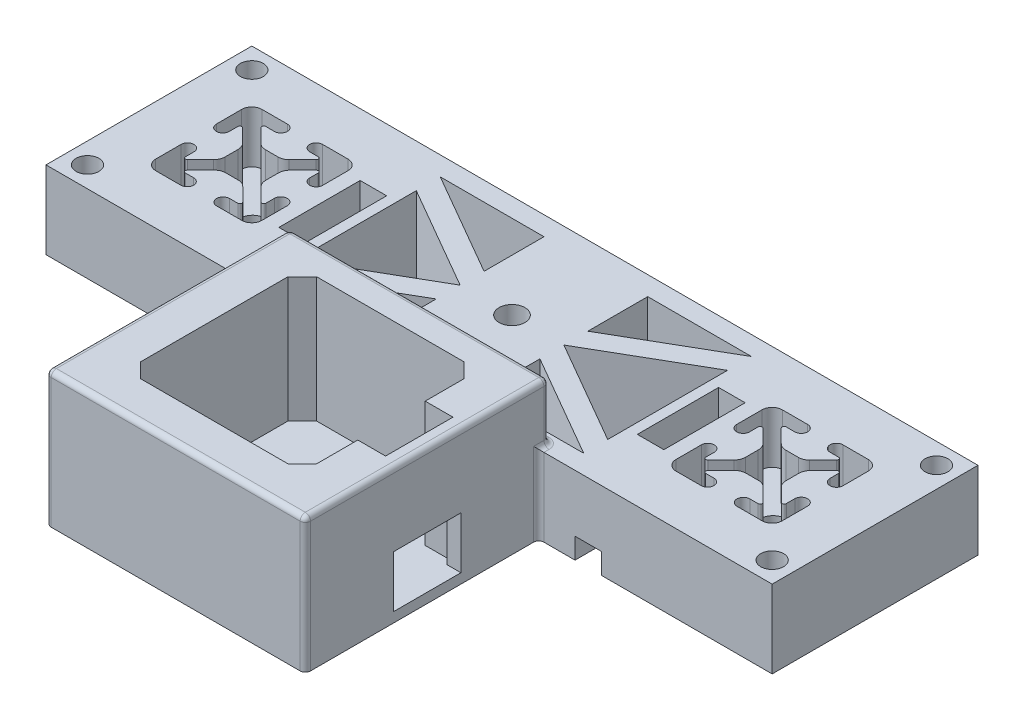
from build123d import *

# Parameters (mm, degrees)
SKETCH1_W               = 177.8
SKETCH1_H               = 50.4000008
BOSS_EXTRUDE1_DEPTH     = 6.35
SKETCH2_W               = 177.8
SKETCH2_H               = 50.4000008
BOSS_EXTRUDE2_DEPTH     = 12.7
SKETCH3_R               = 3.175
CUT_EXTRUDE1_DEPTH      = 186.784559586
CUT_EXTRUDE2_DEPTH      = 186.784559586
SKETCH5_W               = 6.5
SKETCH5_H               = 19.9
CUT_EXTRUDE3_DEPTH      = 10.2
SKETCH6_W               = 6.5
SKETCH6_H               = 4.572
CUT_EXTRUDE4_DEPTH      = 186.086574555
CUT_EXTRUDE5_DEPTH      = 186.241167349
CUT_EXTRUDE5_DEPTH_BACK = 186.241167349
SKETCH7_R               = 2.921
CUT_EXTRUDE6_DEPTH      = 186.241167349
CUT_EXTRUDE6_DEPTH_BACK = 186.241167349
SKETCH8_R               = 2.921
CHAMFER2_SIZE           = 3.302
CHAMFER3_SIZE           = 3.302
CUT_EXTRUDE8_DEPTH      = 5.08
BOSS_EXTRUDE4_DEPTH     = 33.02
CUT_EXTRUDE9_DEPTH      = 30.6
SKETCH13_W              = 16.5
SKETCH13_H              = 12.7
CUT_EXTRUDE10_DEPTH     = 30.6
FILLET1_R               = 1.27
SKETCH14_R              = 2.921
CUT_EXTRUDE11_DEPTH     = 190.249365917
SKETCH15_R              = 10.16
CUT_EXTRUDE12_DEPTH     = 8.128
SKETCH16_R              = 2.794
CUT_EXTRUDE13_DEPTH     = 188.728167838


with BuildPart() as part:
    # Sketch1 → Boss-Extrude1 (new body)
    with BuildSketch(Plane(origin=(0, 0, 0), x_dir=(1, 0, 0), z_dir=(0, 1, 0))):
        with Locations((88.9, 25.2000004)):
            Rectangle(SKETCH1_W, SKETCH1_H)
    extrude(amount=BOSS_EXTRUDE1_DEPTH)

    # Sketch2 → Boss-Extrude2 (add)
    with BuildSketch(Plane(origin=(0, 6.35, 0), x_dir=(1, 0, 0), z_dir=(0, 1, 0))):
        with Locations((88.9, 25.2000004)):
            Rectangle(SKETCH2_W, SKETCH2_H)
        with BuildLine():
            Line((38.207602115, 29.52001185), (38.207602115, 35.7371571))
            ThreePointArc((38.207602115, 35.7371571), (37.48390875, 37.484307436), (35.736758415, 38.2080008))
            Line((35.736758415, 38.2080008), (29.519613165, 38.2080008))
            ThreePointArc((29.519613165, 38.2080008), (27.941613165, 36.6300008), (29.519613165, 35.0520008))
            Line((29.519613165, 35.0520008), (31.618952135, 35.0520008))
            ThreePointArc((31.618952135, 35.0520008), (32.082805957, 34.741944038), (31.973665066, 34.194784253))
            Line((31.973665066, 34.194784253), (28.637609194, 30.863479703))
            ThreePointArc((28.637609194, 30.863479703), (27.774459736, 30.287408726), (26.756632806, 30.085138862))
            Line((26.756632806, 30.085138862), (23.642969309, 30.085138862))
            ThreePointArc((23.642969309, 30.085138862), (22.625142379, 30.287408726), (21.761992921, 30.863479703))
            Line((21.761992921, 30.863479703), (18.425937049, 34.194784253))
            ThreePointArc((18.425937049, 34.194784253), (18.316796158, 34.741944038), (18.78064998, 35.0520008))
            Line((18.78064998, 35.0520008), (20.87998895, 35.0520008))
            ThreePointArc((20.87998895, 35.0520008), (22.45798895, 36.6300008), (20.87998895, 38.2080008))
            Line((20.87998895, 38.2080008), (14.6628437, 38.2080008))
            ThreePointArc((14.6628437, 38.2080008), (12.915693364, 37.484307436), (12.192, 35.7371571))
            Line((12.192, 35.7371571), (12.192, 29.52001185))
            ThreePointArc((12.192, 29.52001185), (13.77, 27.94201185), (15.348, 29.52001185))
            Line((15.348, 29.52001185), (15.348, 31.596493464))
            ThreePointArc((15.348, 31.596493464), (15.657726258, 32.060210386), (16.204710632, 31.95171231))
            Line((16.204710632, 31.95171231), (19.406929995, 28.754053655))
            ThreePointArc((19.406929995, 28.754053655), (20.019806023, 27.837880259), (20.235040084, 26.756832148))
            Line((20.235040084, 26.756832148), (20.235040084, 23.643168652))
            ThreePointArc((20.235040084, 23.643168652), (20.019806023, 22.562120541), (19.406929995, 21.645947145))
            Line((19.406929995, 21.645947145), (16.204710632, 18.44828849))
            ThreePointArc((16.204710632, 18.44828849), (15.657726258, 18.339790414), (15.348, 18.803507336))
            Line((15.348, 18.803507336), (15.348, 20.87998895))
            ThreePointArc((15.348, 20.87998895), (13.77, 22.45798895), (12.192, 20.87998895))
            Line((12.192, 20.87998895), (12.192, 14.6628437))
            ThreePointArc((12.192, 14.6628437), (12.915693364, 12.915693364), (14.6628437, 12.192))
            Line((14.6628437, 12.192), (20.812064149, 12.192))
            ThreePointArc((20.812064149, 12.192), (22.390064149, 13.77), (20.812064149, 15.348))
            Line((20.812064149, 15.348), (18.78064998, 15.348))
            ThreePointArc((18.78064998, 15.348), (18.316796158, 15.658056762), (18.425937049, 16.205216547))
            Line((18.425937049, 16.205216547), (21.761992921, 19.536521097))
            ThreePointArc((21.761992921, 19.536521097), (22.625142379, 20.112592074), (23.642969309, 20.314861938))
            Line((23.642969309, 20.314861938), (26.756632806, 20.314861938))
            ThreePointArc((26.756632806, 20.314861938), (27.774459736, 20.112592074), (28.637609194, 19.536521097))
            Line((28.637609194, 19.536521097), (31.973665066, 16.205216547))
            ThreePointArc((31.973665066, 16.205216547), (32.082805957, 15.658056762), (31.618952135, 15.348))
            Line((31.618952135, 15.348), (29.587537966, 15.348))
            ThreePointArc((29.587537966, 15.348), (28.009537966, 13.77), (29.587537966, 12.192))
            Line((29.587537966, 12.192), (35.736758415, 12.192))
            ThreePointArc((35.736758415, 12.192), (37.48390875, 12.915693364), (38.207602115, 14.6628437))
            Line((38.207602115, 14.6628437), (38.207602115, 20.87998895))
            ThreePointArc((38.207602115, 20.87998895), (36.629602115, 22.45798895), (35.051602115, 20.87998895))
            Line((35.051602115, 20.87998895), (35.051602115, 18.803507336))
            ThreePointArc((35.051602115, 18.803507336), (34.741875857, 18.339790414), (34.194891482, 18.44828849))
            Line((34.194891482, 18.44828849), (30.99267212, 21.645947145))
            ThreePointArc((30.99267212, 21.645947145), (30.379796092, 22.562120541), (30.16456203, 23.643168652))
            Line((30.16456203, 23.643168652), (30.16456203, 26.756832148))
            ThreePointArc((30.16456203, 26.756832148), (30.379796092, 27.837880259), (30.99267212, 28.754053655))
            Line((30.99267212, 28.754053655), (34.194891482, 31.95171231))
            ThreePointArc((34.194891482, 31.95171231), (34.741875857, 32.060210386), (35.051602115, 31.596493464))
            Line((35.051602115, 31.596493464), (35.051602115, 29.52001185))
            ThreePointArc((35.051602115, 29.52001185), (36.629602115, 27.94201185), (38.207602115, 29.52001185))
        make_face(mode=Mode.SUBTRACT)
        with BuildLine():
            Line((142.748397885, 31.596493464), (142.748397885, 29.52001185))
            ThreePointArc((142.748397885, 29.52001185), (141.170397885, 27.94201185), (139.592397885, 29.52001185))
            Line((139.592397885, 29.52001185), (139.592397885, 35.7371571))
            ThreePointArc((139.592397885, 35.7371571), (140.31609125, 37.484307436), (142.063241585, 38.2080008))
            Line((142.063241585, 38.2080008), (148.280386835, 38.2080008))
            ThreePointArc((148.280386835, 38.2080008), (149.858386835, 36.6300008), (148.280386835, 35.0520008))
            Line((148.280386835, 35.0520008), (146.181047865, 35.0520008))
            ThreePointArc((146.181047865, 35.0520008), (145.717194043, 34.741944038), (145.826334934, 34.194784253))
            Line((145.826334934, 34.194784253), (149.162390806, 30.863479703))
            ThreePointArc((149.162390806, 30.863479703), (150.025540264, 30.287408726), (151.043367194, 30.085138862))
            Line((151.043367194, 30.085138862), (154.157030691, 30.085138862))
            ThreePointArc((154.157030691, 30.085138862), (155.174857621, 30.287408726), (156.038007079, 30.863479703))
            Line((156.038007079, 30.863479703), (159.374062951, 34.194784253))
            ThreePointArc((159.374062951, 34.194784253), (159.483203842, 34.741944038), (159.01935002, 35.0520008))
            Line((159.01935002, 35.0520008), (156.92001105, 35.0520008))
            ThreePointArc((156.92001105, 35.0520008), (155.34201105, 36.6300008), (156.92001105, 38.2080008))
            Line((156.92001105, 38.2080008), (163.1371563, 38.2080008))
            ThreePointArc((163.1371563, 38.2080008), (164.884306636, 37.484307436), (165.608, 35.7371571))
            Line((165.608, 35.7371571), (165.608, 29.52001185))
            ThreePointArc((165.608, 29.52001185), (164.03, 27.94201185), (162.452, 29.52001185))
            Line((162.452, 29.52001185), (162.452, 31.596493464))
            ThreePointArc((162.452, 31.596493464), (162.142273742, 32.060210386), (161.595289368, 31.95171231))
            Line((161.595289368, 31.95171231), (158.393070005, 28.754053655))
            ThreePointArc((158.393070005, 28.754053655), (157.780193977, 27.837880259), (157.564959916, 26.756832148))
            Line((157.564959916, 26.756832148), (157.564959916, 23.643168652))
            ThreePointArc((157.564959916, 23.643168652), (157.780193977, 22.562120541), (158.393070005, 21.645947145))
            Line((158.393070005, 21.645947145), (161.595289368, 18.44828849))
            ThreePointArc((161.595289368, 18.44828849), (162.142273742, 18.339790414), (162.452, 18.803507336))
            Line((162.452, 18.803507336), (162.452, 20.87998895))
            ThreePointArc((162.452, 20.87998895), (164.03, 22.45798895), (165.608, 20.87998895))
            Line((165.608, 20.87998895), (165.608, 14.6628437))
            ThreePointArc((165.608, 14.6628437), (164.884306636, 12.915693364), (163.1371563, 12.192))
            Line((163.1371563, 12.192), (156.987935851, 12.192))
            ThreePointArc((156.987935851, 12.192), (155.409935851, 13.77), (156.987935851, 15.348))
            Line((156.987935851, 15.348), (159.01935002, 15.348))
            ThreePointArc((159.01935002, 15.348), (159.483203842, 15.658056762), (159.374062951, 16.205216547))
            Line((159.374062951, 16.205216547), (156.038007079, 19.536521097))
            ThreePointArc((156.038007079, 19.536521097), (155.174857621, 20.112592074), (154.157030691, 20.314861938))
            Line((154.157030691, 20.314861938), (151.043367194, 20.314861938))
            ThreePointArc((151.043367194, 20.314861938), (150.025540264, 20.112592074), (149.162390806, 19.536521097))
            Line((149.162390806, 19.536521097), (145.826334934, 16.205216547))
            ThreePointArc((145.826334934, 16.205216547), (145.717194043, 15.658056762), (146.181047865, 15.348))
            Line((146.181047865, 15.348), (148.212462034, 15.348))
            ThreePointArc((148.212462034, 15.348), (149.790462034, 13.77), (148.212462034, 12.192))
            Line((148.212462034, 12.192), (142.063241585, 12.192))
            ThreePointArc((142.063241585, 12.192), (140.31609125, 12.915693364), (139.592397885, 14.6628437))
            Line((139.592397885, 14.6628437), (139.592397885, 20.87998895))
            ThreePointArc((139.592397885, 20.87998895), (141.170397885, 22.45798895), (142.748397885, 20.87998895))
            Line((142.748397885, 20.87998895), (142.748397885, 18.803507336))
            ThreePointArc((142.748397885, 18.803507336), (143.058124143, 18.339790414), (143.605108518, 18.44828849))
            Line((143.605108518, 18.44828849), (146.80732788, 21.645947145))
            ThreePointArc((146.80732788, 21.645947145), (147.420203908, 22.562120541), (147.63543797, 23.643168652))
            Line((147.63543797, 23.643168652), (147.63543797, 26.756832148))
            ThreePointArc((147.63543797, 26.756832148), (147.420203908, 27.837880259), (146.80732788, 28.754053655))
            Line((146.80732788, 28.754053655), (143.605108518, 31.95171231))
            ThreePointArc((143.605108518, 31.95171231), (143.058124143, 32.060210386), (142.748397885, 31.596493464))
        make_face(mode=Mode.SUBTRACT)
    extrude(amount=BOSS_EXTRUDE2_DEPTH)

    # Sketch3 → Cut-Extrude1 (cut, through all)
    with BuildSketch(Plane(origin=(0, 19.05, 0), x_dir=(1, 0, 0), z_dir=(0, 1, 0))):
        with Locations((88.9, 25.2000004)):
            Circle(SKETCH3_R)
    extrude(amount=-CUT_EXTRUDE1_DEPTH, mode=Mode.SUBTRACT)

    # Sketch4 → Cut-Extrude2 (cut, through all)
    with BuildSketch(Plane(origin=(0, 19.05, 0), x_dir=(1, 0, 0), z_dir=(0, 1, 0))):
        Polygon((50.8, 45.730575972), (76.2, 45.730575972), (76.2, 31.065879135), align=None)
        Polygon((76.2, 19.334121665), (76.2, 4.669424828), (50.8, 4.669424828), align=None)
        Polygon((50.8, 39.864697237), (50.8, 10.535303563), (76.2, 25.2000004), align=None)
        Polygon((101.6, 25.2000004), (127, 39.864697237), (127, 10.535303563), align=None)
        Polygon((127, 4.669424828), (101.6, 19.334121665), (101.6, 4.669424828), align=None)
        Polygon((101.6, 31.065879135), (127, 45.730575972), (101.6, 45.730575972), align=None)
    extrude(amount=-CUT_EXTRUDE2_DEPTH, mode=Mode.SUBTRACT)

    # Sketch5 → Cut-Extrude3 (cut)
    with BuildSketch(Plane(origin=(0, 19.05, 0), x_dir=(1, 0, 0), z_dir=(0, 1, 0))):
        with Locations((45.013602115, 25.2000004)):
            Rectangle(SKETCH5_W, SKETCH5_H)
    cut_extrude3 = extrude(amount=-CUT_EXTRUDE3_DEPTH, mode=Mode.SUBTRACT)

    # Sketch6 → Cut-Extrude4 (cut, through all)
    with BuildSketch(Plane(origin=(0, 8.85, 0), x_dir=(1, 0, 0), z_dir=(0, 1, 0))):
        with Locations((45.013602115, 32.8640004)):
            Rectangle(SKETCH6_W, SKETCH6_H)
        with Locations((45.013602115, 25.2000004)):
            Rectangle(SKETCH6_W, SKETCH6_H)
        with Locations((45.013602115, 17.5360004)):
            Rectangle(SKETCH6_W, SKETCH6_H)
    cut_extrude4 = extrude(amount=-CUT_EXTRUDE4_DEPTH, mode=Mode.SUBTRACT)

    # Mirror1: Cut-Extrude3, Cut-Extrude4 across plane
    add(cut_extrude3.mirror(Plane.ZY.offset(-88.9)), mode=Mode.SUBTRACT)
    add(cut_extrude4.mirror(Plane.ZY.offset(-88.9)), mode=Mode.SUBTRACT)

    # Sketch7 → Cut-Extrude5 (cut, two sides: drawn at the far end of the back side and taken through both)
    with BuildSketch(Plane(origin=(0, 6.35, 0), x_dir=(1, 0, 0), z_dir=(0, 1, 0)).offset(-CUT_EXTRUDE5_DEPTH_BACK)):
        with Locations((25.33856203, 25.259138862)):
            Circle(SKETCH7_R)
    extrude(amount=CUT_EXTRUDE5_DEPTH + CUT_EXTRUDE5_DEPTH_BACK, mode=Mode.SUBTRACT)

    # Sketch8 → Cut-Extrude6 (cut, two sides: drawn at the far end of the back side and taken through both)
    with BuildSketch(Plane(origin=(0, 6.35, 0), x_dir=(1, 0, 0), z_dir=(0, 1, 0)).offset(-CUT_EXTRUDE6_DEPTH_BACK)):
        with Locations((152.738959916, 25.259138862)):
            Circle(SKETCH8_R)
    extrude(amount=CUT_EXTRUDE6_DEPTH + CUT_EXTRUDE6_DEPTH_BACK, mode=Mode.SUBTRACT)

    # Chamfer2
    chamfer2_edges = [part.edges().sort_by_distance(p)[0] for p in [
        (149.817959916, 0, -25.259138862),
    ]]
    chamfer(chamfer2_edges, length=CHAMFER2_SIZE)

    # Chamfer3
    chamfer3_edges = [part.edges().sort_by_distance(p)[0] for p in [
        (22.41756203, 0, -25.259138862),
    ]]
    chamfer(chamfer3_edges, length=CHAMFER3_SIZE)

    # Sketch11 → Cut-Extrude8 (cut)
    with BuildSketch(Plane(origin=(0, 0, 0), x_dir=(1, 0, 0), z_dir=(0, 1, 0))):
        Polygon((41.763602115, 15.2500004), (41.763602115, 0), (48.263602115, 0), (48.263602115, 15.2500004), (48.263602115, 35.1500004), (48.263602115, 50.4000008), (41.763602115, 50.4000008), (41.763602115, 35.1500004), align=None)
        Polygon((136.036397885, 0), (129.536397885, 0), (129.536397885, 15.2500004), (129.536397885, 35.1500004), (129.536397885, 50.4000008), (136.036397885, 50.4000008), (136.036397885, 35.1500004), (136.036397885, 15.2500004), align=None)
    extrude(amount=CUT_EXTRUDE8_DEPTH, mode=Mode.SUBTRACT)

    # Sketch9 → Boss-Extrude4 (add)
    with BuildSketch(Plane(origin=(0, 0, 0), x_dir=(1, 0, 0), z_dir=(0, 1, 0))):
        Polygon((120.65, 0), (120.65, -57.15), (57.15, -57.15), (57.15, 0), (57.15, 2.54), (120.65, 2.54), align=None)
    extrude(amount=BOSS_EXTRUDE4_DEPTH)

    # Sketch12 → Cut-Extrude9 (cut)
    with BuildSketch(Plane(origin=(0, 33.02, 0), x_dir=(1, 0, 0), z_dir=(0, 1, 0))):
        Polygon((70.845533906, -4.555999524), (106.954466094, -4.555999524), (110.49, -8.09153343), (110.49, -17.6419996), (117.29, -17.6419996), (117.29, -34.1419996), (110.49, -34.1419996), (110.49, -44.200465618), (106.954466094, -47.735999524), (70.845533906, -47.735999524), (67.31, -44.200465618), (67.31, -8.09153343), align=None)
    extrude(amount=-CUT_EXTRUDE9_DEPTH, mode=Mode.SUBTRACT)

    # Sketch13 → Cut-Extrude10 (cut)
    with BuildSketch(Plane(origin=(120.65, 0, 0), x_dir=(0, 0, -1), z_dir=(1, 0, 0))):
        with Locations((-27.305, 8.77)):
            Rectangle(SKETCH13_W, SKETCH13_H)
    extrude(amount=-CUT_EXTRUDE10_DEPTH, mode=Mode.SUBTRACT)

    # Fillet1
    fillet1_edges = [part.edges().sort_by_distance(p)[0] for p in [
        (120.65, 19.05, -1.27),
        (57.15, 19.05, -1.27),
        (120.65, 26.035, -2.54),
        (57.15, 26.035, -2.54),
        (88.9, 19.05, -2.54),
        (57.15, 9.525, 0),
        (120.65, 9.525, 0),
        (120.65, 33.02, 27.305),
        (120.65, 16.51, 57.15),
        (88.9, 33.02, 57.15),
        (57.15, 33.02, 27.305),
        (57.15, 16.51, 57.15),
        (88.9, 33.02, -2.54),
    ]]
    fillet(fillet1_edges, radius=FILLET1_R)

    # Sketch14 → Cut-Extrude11 (cut, through all)
    with BuildSketch(Plane(origin=(0, 2.42, 0), x_dir=(1, 0, 0), z_dir=(0, 1, 0))):
        with Locations((88.9, -26.145999524)):
            Circle(SKETCH14_R)
    extrude(amount=-CUT_EXTRUDE11_DEPTH, mode=Mode.SUBTRACT)

    # Sketch15 → Cut-Extrude12 (cut)
    with BuildSketch(Plane(origin=(0, 0, 0), x_dir=(1, 0, 0), z_dir=(0, 1, 0))):
        with Locations((88.9, 25.2000004)):
            Circle(SKETCH15_R)
    extrude(amount=CUT_EXTRUDE12_DEPTH, mode=Mode.SUBTRACT)

    # Sketch16 → Cut-Extrude13 (cut, through all)
    with BuildSketch(Plane(origin=(0, 19.05, 0), x_dir=(1, 0, 0), z_dir=(0, 1, 0))):
        with Locations((5.08, 45.3200008)):
            Circle(SKETCH16_R)
        with Locations((5.08, 5.08)):
            Circle(SKETCH16_R)
        with Locations((172.72, 5.08)):
            Circle(SKETCH16_R)
        with Locations((172.72, 45.3200008)):
            Circle(SKETCH16_R)
    extrude(amount=-CUT_EXTRUDE13_DEPTH, mode=Mode.SUBTRACT)


solid = part.part
